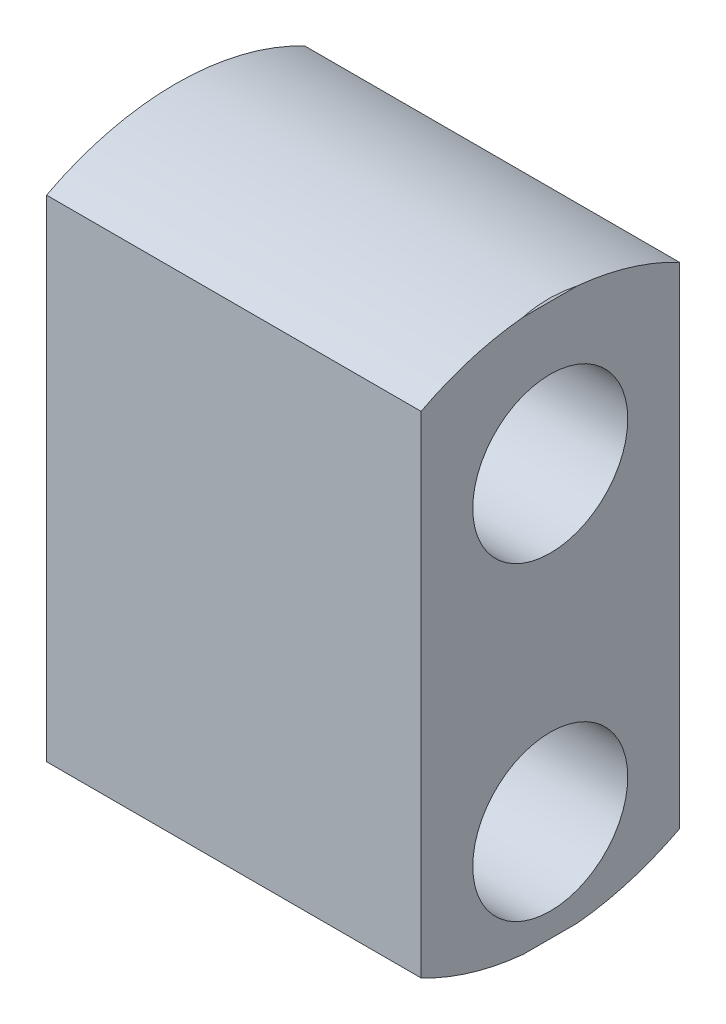
from build123d import *

# Parameters (mm, degrees)
SKETCH1_W               = 14.5
SKETCH1_H               = 30
SKETCH1_R               = 3
BOSS_EXTRUDE1_DEPTH     = 5
CUT_EXTRUDE1_DEPTH      = 30.097274604
CUT_EXTRUDE1_DEPTH_BACK = 30.097274604
SKETCH2_R               = 4
CUT_EXTRUDE2_DEPTH      = 23.16293341
CUT_EXTRUDE2_DEPTH_BACK = 23.16293341
SKETCH3_R               = 3
CUT_EXTRUDE3_DEPTH      = 23.162933498
CUT_EXTRUDE3_DEPTH_BACK = 23.162933498
SKETCH4_R               = 3
BOSS_EXTRUDE5_START     = -10
SKETCH6_R               = 5
BOSS_EXTRUDE5_DEPTH     = 0.1
SKETCH7_R               = 0.4
BOSS_EXTRUDE6_DEPTH     = 9.9
SKETCH8_W               = 10
SKETCH8_H               = 5.416493121
CUT_EXTRUDE5_DEPTH      = 23.162933498
CUT_EXTRUDE6_START      = -10
CUT_EXTRUDE6_DEPTH      = 10
CUT_EXTRUDE7_START      = -14.5
CUT_EXTRUDE7_DEPTH      = 14.5


# Read off the part's stored shape, not the designer's step: Cut-Extrude6, Cut-Extrude7
with BuildPart() as part:
    # Sketch1 → Boss-Extrude1 (new, symmetric)
    with BuildSketch(Plane.XY):
        with Locations((-14.901879651, 0.998300452)):
            Rectangle(SKETCH1_W, SKETCH1_H)
        with Locations((-14.901879651, -4.732232083)):
            Circle(SKETCH1_R, mode=Mode.SUBTRACT)
    extrude(amount=BOSS_EXTRUDE1_DEPTH, both=True)

    # Sketch2 → Cut-Extrude1 (cut, two sides: drawn at the far end of the back side and taken through both)
    with BuildSketch(Plane(origin=(0, 0, -5), x_dir=(-1, 0, 0), z_dir=(0, 0, -1)).offset(-CUT_EXTRUDE1_DEPTH_BACK)):
        with Locations((14.901879651, -4.001699548)):
            Circle(SKETCH2_R)
    extrude(amount=CUT_EXTRUDE1_DEPTH + CUT_EXTRUDE1_DEPTH_BACK, mode=Mode.SUBTRACT)

    # Sketch3 → Cut-Extrude2 (cut, two sides: drawn at the far end of the back side and taken through both)
    with BuildSketch(Plane.ZY.offset(22.151879651).offset(-CUT_EXTRUDE2_DEPTH_BACK)):
        with Locations(Location((0, -8.608931628, 0), (0, 0, 270))):
            Circle(SKETCH3_R)
    extrude(amount=CUT_EXTRUDE2_DEPTH + CUT_EXTRUDE2_DEPTH_BACK, mode=Mode.SUBTRACT)

    # Sketch4 → Cut-Extrude3 (cut, two sides: drawn at the far end of the back side and taken through both)
    with BuildSketch(Plane.ZY.offset(22.151879651).offset(-CUT_EXTRUDE3_DEPTH_BACK)):
        with Locations(Location((0, 3.392776132, 0), (0, 0, 270))):
            Circle(SKETCH4_R)
    extrude(amount=CUT_EXTRUDE3_DEPTH + CUT_EXTRUDE3_DEPTH_BACK, mode=Mode.SUBTRACT)

    # Sketch6 → Boss-Extrude5 (add)
    with BuildSketch(Plane(origin=(0, 0, -5), x_dir=(-1, 0, 0), z_dir=(0, 0, -1)).offset(BOSS_EXTRUDE5_START)):
        with Locations((14.901879651, -4.001699548)):
            Circle(SKETCH6_R)
    extrude(amount=BOSS_EXTRUDE5_DEPTH)

    # Sketch7 → Boss-Extrude6 (add)
    with BuildSketch(Plane(origin=(0, 0, 4.9), x_dir=(-1, 0, 0), z_dir=(0, 0, -1))):
        with Locations(Location((14.901879651, -3.652232083, 0), (0, 0, 180))):
            Circle(SKETCH7_R)
    extrude(amount=BOSS_EXTRUDE6_DEPTH)

    # Sketch8 → Cut-Extrude5 (cut, through all)
    with BuildSketch(Plane(origin=(-7.651879651, 0, 0), x_dir=(0, 0, -1), z_dir=(1, 0, 0))):
        with Locations((0, 13.290053892)):
            Rectangle(SKETCH8_W, SKETCH8_H)
    extrude(amount=-CUT_EXTRUDE5_DEPTH, mode=Mode.SUBTRACT)

    # Cut-Extrude6 outline → Cut-Extrude6 (cut)
    with BuildSketch(Plane(origin=(0, 0, -5), x_dir=(-1, 0, 0), z_dir=(0, 0, -1)).offset(CUT_EXTRUDE6_START)):
        with BuildLine():
            ThreePointArc((7.651879651, 8.831200001), (9.341126693, 9.839033909), (11.162547128, 10.581807331))
            Line((11.162547128, 10.581807331), (7.651879651, 10.581807331))
            Line((7.651879651, 10.581807331), (7.651879651, 8.831200001))
        make_face()
        with BuildLine():
            Line((22.151879651, 10.581807331), (19.178996312, 10.581807331))
            ThreePointArc((19.178996312, 10.581807331), (20.709322329, 9.979718674), (22.151879651, 9.190138504))
            Line((22.151879651, 9.190138504), (22.151879651, 10.581807331))
        make_face()
        with BuildLine():
            ThreePointArc((10.371064905, -14.001699548), (8.967948653, -13.348856833), (7.651879651, -12.534669381))
            Line((7.651879651, -12.534669381), (7.651879651, -14.001699548))
            Line((7.651879651, -14.001699548), (10.371064905, -14.001699548))
        make_face()
        with BuildLine():
            Line((22.151879651, -14.001699548), (22.151879651, -12.893607884))
            ThreePointArc((22.151879651, -12.893607884), (21.087178214, -13.498835864), (19.970478535, -14.001699548))
            Line((19.970478535, -14.001699548), (22.151879651, -14.001699548))
        make_face()
    extrude(amount=CUT_EXTRUDE6_DEPTH, mode=Mode.SUBTRACT)

    # Cut-Extrude7 outline → Cut-Extrude7 (cut)
    with BuildSketch(Plane(origin=(-7.651879651, 0, 0), x_dir=(0, 0, -1), z_dir=(1, 0, 0)).offset(CUT_EXTRUDE7_START)):
        with BuildLine():
            ThreePointArc((5, -11.350842885), (0, -12.5864008), (-5, -11.350842885))
            Line((-5, -11.350842885), (-5, -14.001699548))
            Line((-5, -14.001699548), (5, -14.001699548))
            Line((5, -14.001699548), (5, -11.350842885))
        make_face()
        with BuildLine():
            Line((-5, 10.581807331), (-5, 7.647373505))
            ThreePointArc((-5, 7.647373505), (0, 8.882931421), (5, 7.647373505))
            Line((5, 7.647373505), (5, 10.581807331))
            Line((5, 10.581807331), (-5, 10.581807331))
        make_face()
    extrude(amount=CUT_EXTRUDE7_DEPTH, mode=Mode.SUBTRACT)


solid = part.part
